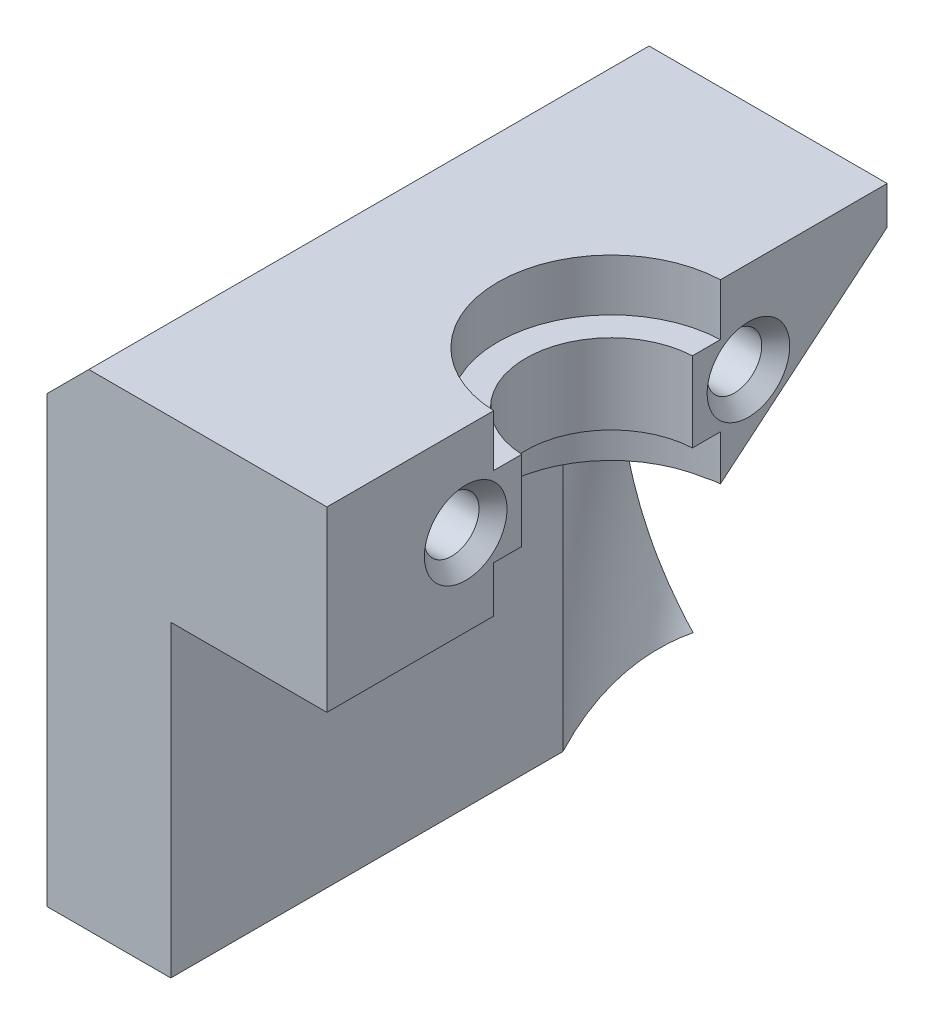
from build123d import *

# Parameters (mm, degrees)
SKETCH1_W               = 40
SKETCH1_H               = 34.7
BOSS_EXTRUDE1_DEPTH     = 20
SKETCH2_R               = 8.1
CUT_EXTRUDE1_DEPTH      = 12.7
SKETCH5_W               = 11.15
SKETCH5_H               = 40
CUT_EXTRUDE5_DEPTH      = 22
SKETCH9_R               = 8.1
SKETCH9_R_2             = 6.1
BOSS_EXTRUDE2_DEPTH     = 5.7
CUT_EXTRUDE6_DEPTH      = 57.604681952
CUT_EXTRUDE6_DEPTH_BACK = 57.604681952
SKETCH10_W              = 12
SKETCH10_H              = 40
SKETCH11_R              = 1.95
CUT_EXTRUDE7_DEPTH      = 8
CHAMFER1_SIZE           = 1
SKETCH12_R              = 1.95
CUT_EXTRUDE8_DEPTH      = 54.889609545
CHAMFER2_SIZE           = 1
SKETCH15_R              = 1.95
CUT_EXTRUDE11_DEPTH     = 10
CHAMFER3_SIZE           = 1
CHAMFER7_SIZE           = 3


with BuildPart() as part:
    # Sketch1 → Boss-Extrude1 (new body)
    with BuildSketch(Plane(origin=(0, 0, 0), x_dir=(0, 0, -1), z_dir=(1, 0, 0))):
        with Locations((20, 17.35)):
            Rectangle(SKETCH1_W, SKETCH1_H)
    extrude(amount=-BOSS_EXTRUDE1_DEPTH)

    # Sketch2 → Cut-Extrude1 (cut)
    with BuildSketch(Plane(origin=(0, 34.7, 0), x_dir=(1, 0, 0), z_dir=(0, 1, 0))):
        with Locations((0.3, 20)):
            Circle(SKETCH2_R)
    extrude(amount=-CUT_EXTRUDE1_DEPTH, mode=Mode.SUBTRACT)

    # Sketch5 → Cut-Extrude5 (cut)
    with BuildSketch(Plane.XZ):
        with Locations((-5.575, -20)):
            Rectangle(SKETCH5_W, SKETCH5_H)
    extrude(amount=-CUT_EXTRUDE5_DEPTH, mode=Mode.SUBTRACT)

    # Cut-Loft1: read off the stored shape, not the designer's step
    # Cut-Loft1: loft between two sections, ruled curve by curve
    cut_loft1_from = [
        Edge.make_bspline([(11.243514961, 28.316114759, -40), (10.488221253, 28.870573657, -40), (9.673151561, 29.382537078, -40), (7.939112522, 30.28953078, -40), (7.020163395, 30.684407436, -40), (5.104947281, 31.329224581, -40), (4.108776624, 31.579024462, -40), (2.074994957, 31.914454558, -40), (1.037543565, 32, -40), (-1.037543565, 32, -40), (-2.074994957, 31.914454558, -40), (-4.108776624, 31.579024462, -40), (-5.104947281, 31.329224581, -40), (-7.020163395, 30.684407436, -40), (-7.939112522, 30.28953078, -40), (-9.673151561, 29.382537078, -40), (-10.488221253, 28.870573657, -40), (-11.243514961, 28.316114759, -40)], [0, 0, 0, 0, 0.125, 0.125, 0.25, 0.25, 0.375, 0.375, 0.5, 0.5, 0.625, 0.625, 0.75, 0.75, 0.875, 0.875, 1, 1, 1, 1], 3),
        Edge.make_bspline([(-11.243514961, 28.316114759, -40), (-12.272389396, 27.560821051, -40), (-13.278735727, 26.661602289, -40), (-15.139556406, 24.56538073, -40), (-15.993134823, 23.367779698, -40), (-17.42758787, 20.71689046, -40), (-18.007136515, 19.263731202, -40), (-18.79386095, 16.206568982, -40), (-19, 14.603683637, -40), (-19, 11.396316363, -40), (-18.79386095, 9.793431018, -40), (-18.007136515, 6.736268798, -40), (-17.42758787, 5.28310954, -40), (-15.993134823, 2.632220302, -40), (-15.139556406, 1.43461927, -40), (-13.278735727, -0.661602289, -40), (-12.272389396, -1.560821051, -40), (-11.243514961, -2.316114759, -40)], [0, 0, 0, 0, 0.125, 0.125, 0.25, 0.25, 0.375, 0.375, 0.5, 0.5, 0.625, 0.625, 0.75, 0.75, 0.875, 0.875, 1, 1, 1, 1], 3),
        Edge.make_line((-11.243514961, -2.316114759, -40), (11.243514961, 28.316114759, -40)),
    ]
    cut_loft1_to = [
        Edge.make_bspline([(11.85, 22, -28), (10.891666667, 22, -28), (9.933333333, 22, -28), (8.016666667, 22, -28), (7.058333333, 22, -28), (5.141666667, 22, -28), (4.183333333, 22, -28), (2.266666667, 22, -28), (1.308333333, 22, -28), (-0.608333333, 22, -28), (-1.566666667, 22, -28), (-3.483333333, 22, -28), (-4.441666667, 22, -28), (-6.358333333, 22, -28), (-7.316666667, 22, -28), (-9.233333333, 22, -28), (-10.191666667, 22, -28), (-11.15, 22, -28)], [0, 0, 0, 0, 0.125, 0.125, 0.25, 0.25, 0.375, 0.375, 0.5, 0.5, 0.625, 0.625, 0.75, 0.75, 0.875, 0.875, 1, 1, 1, 1], 3),
        Edge.make_bspline([(-11.15, 22, -28), (-11.15, 20.694541399, -28), (-11.15, 19.389082798, -28), (-11.15, 16.778165596, -28), (-11.15, 15.472706995, -28), (-11.15, 12.861789793, -28), (-11.15, 11.556331192, -28), (-11.15, 8.94541399, -28), (-11.15, 7.639955389, -28), (-11.15, 5.029038187, -28), (-11.15, 3.723579586, -28), (-11.15, 1.112662384, -28), (-11.15, -0.192796217, -28), (-11.15, -2.803713419, -28), (-11.15, -4.10917202, -28), (-11.15, -6.720089222, -28), (-11.15, -8.025547823, -28), (-11.15, -9.331006424, -28)], [0, 0, 0, 0, 0.125, 0.125, 0.25, 0.25, 0.375, 0.375, 0.5, 0.5, 0.625, 0.625, 0.75, 0.75, 0.875, 0.875, 1, 1, 1, 1], 3),
        Edge.make_line((-11.15, -9.331006424, -28), (11.85, 22, -28)),
    ]
    cut_loft1 = Solid(Shell([*[Face.make_surface_from_curves(cut_loft1_from[k], cut_loft1_to[k]) for k in range(3)], Face(Wire(cut_loft1_from)), Face(Wire(cut_loft1_to))]))
    add(cut_loft1, mode=Mode.SUBTRACT)

    # Sketch9 → Boss-Extrude2 (add)
    with BuildSketch(Plane(origin=(0, 31, 0), x_dir=(1, 0, 0), z_dir=(0, 1, 0))):
        with Locations((0.3, 20)):
            Circle(SKETCH9_R)
        with Locations(Location((0.3, 20, 0), (0, 0, 270))):
            Circle(SKETCH9_R_2, mode=Mode.SUBTRACT)
    extrude(amount=-BOSS_EXTRUDE2_DEPTH)

    # Sketch10 → Cut-Extrude6 (cut, two sides: drawn at the far end of the back side and taken through both)
    with BuildSketch(Plane(origin=(0, 0, 0), x_dir=(1, 0, 0), z_dir=(0, 1, 0)).offset(-CUT_EXTRUDE6_DEPTH_BACK)):
        with Locations((6, 20)):
            Rectangle(SKETCH10_W, SKETCH10_H)
    extrude(amount=CUT_EXTRUDE6_DEPTH + CUT_EXTRUDE6_DEPTH_BACK, mode=Mode.SUBTRACT)

    # Sketch11 → Cut-Extrude7 (cut)
    with BuildSketch(Plane.XZ):
        with Locations(Location((-15.575, -13.907381515, 0), (0, 0, 270))):
            Circle(SKETCH11_R)
        with Locations(Location((-15.575, -26.092618485, 0), (0, 0, 270))):
            Circle(SKETCH11_R)
    extrude(amount=-CUT_EXTRUDE7_DEPTH, mode=Mode.SUBTRACT)

    # Chamfer1
    chamfer1_edges = [part.edges().sort_by_distance(p)[0] for p in [
        (-15.575, 0, -11.957381515),
        (-15.575, 0, -24.142618485),
    ]]
    chamfer(chamfer1_edges, length=CHAMFER1_SIZE)

    # Sketch12 → Cut-Extrude8 (cut, through all)
    with BuildSketch(Plane(origin=(-10, 0, 0), x_dir=(0, 0, -1), z_dir=(1, 0, 0))):
        with Locations(Location((9.907381515, 28.15, 0), (0, 0, 180))):
            Circle(SKETCH12_R)
        with Locations(Location((30.092618485, 28.15, 0), (0, 0, 180))):
            Circle(SKETCH12_R)
    extrude(amount=CUT_EXTRUDE8_DEPTH, mode=Mode.SUBTRACT)

    # Chamfer2
    chamfer2_edges = [part.edges().sort_by_distance(p)[0] for p in [
        (0, 28.15, -11.857381515),
        (0, 28.15, -32.042618485),
    ]]
    chamfer(chamfer2_edges, length=CHAMFER2_SIZE)

    # Sketch15 → Cut-Extrude11 (cut)
    with BuildSketch(Plane(origin=(0, 0, -40), x_dir=(-1, 0, 0), z_dir=(0, 0, -1))):
        with Locations((16, 29)):
            Circle(SKETCH15_R)
    extrude(amount=-CUT_EXTRUDE11_DEPTH, mode=Mode.SUBTRACT)

    # Chamfer3
    chamfer3_edges = [part.edges().sort_by_distance(p)[0] for p in [
        (-14.05, 29, -40),
    ]]
    chamfer(chamfer3_edges, length=CHAMFER3_SIZE)

    # Chamfer7
    chamfer7_edges = [part.edges().sort_by_distance(p)[0] for p in [
        (-20, 34.7, -20),
    ]]
    chamfer(chamfer7_edges, length=CHAMFER7_SIZE)


solid = part.part
